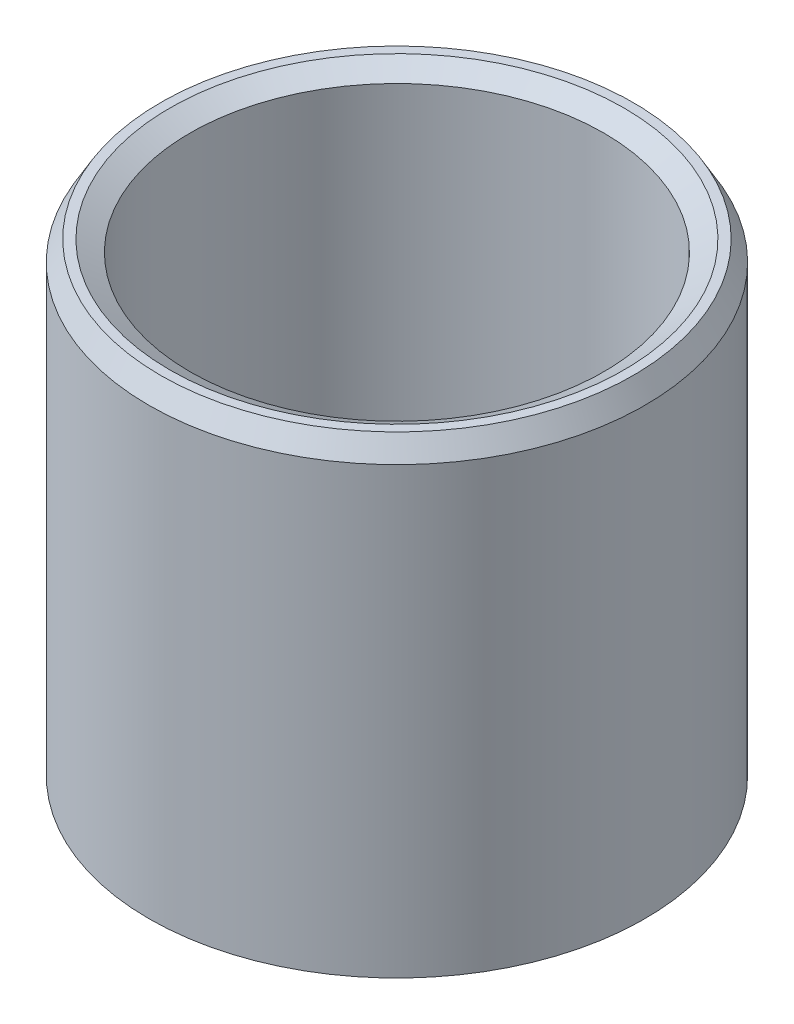
from build123d import *
from OCP.BRepFilletAPI import BRepFilletAPI_MakeChamfer

# Parameters (mm, degrees)
SKETCH1_R           = 42.5
BOSS_EXTRUDE1_DEPTH = 81.645360636
SKETCH2_R           = 35.456587129
CUT_EXTRUDE1_DEPTH  = 102.38276438
CHAMFER1_SIZE       = 3.449317641
CHAMFER1_SIZE2      = 1.991464468


with BuildPart() as part:
    # Sketch1 → Boss-Extrude1 (new body)
    with BuildSketch(Plane(origin=(0, 0, 0), x_dir=(1, 0, 0), z_dir=(0, 1, 0))):
        Circle(SKETCH1_R)
    extrude(amount=BOSS_EXTRUDE1_DEPTH)

    # Sketch2 → Cut-Extrude1 (cut, through all)
    with BuildSketch(Plane(origin=(0, 0, 0), x_dir=(1, 0, 0), z_dir=(0, 1, 0))):
        Circle(SKETCH2_R)
    extrude(amount=CUT_EXTRUDE1_DEPTH, mode=Mode.SUBTRACT)

    # Chamfer1: one chamfer whose edges measure the first distance from different faces: ONE call of the kernel's chamfer builder (chamfer() names one face for all edges)
    chamfer1_edges_1 = [part.edges().sort_by_distance(p)[0] for p in [
        (-35.456587129, 81.645360636, 0),
    ]]
    chamfer1_side_1 = [part.faces().sort_by_distance(p)[0] for p in [
        (-41.297918472, 81.645360636, 0),
    ]]
    chamfer1_edges_2 = [part.edges().sort_by_distance(p)[0] for p in [
        (-35.456587129, 0, 0),
    ]]
    chamfer1_side_2 = [part.faces().sort_by_distance(p)[0] for p in [
        (-35.456587129, 40.822680318, 0),
    ]]
    chamfer1_edges_3 = [part.edges().sort_by_distance(p)[0] for p in [
        (-42.5, 0, 0),
    ]]
    chamfer1_side_3 = [part.faces().sort_by_distance(p)[0] for p in [
        (-41.297918472, 0, 0),
    ]]
    chamfer1_edges_4 = [part.edges().sort_by_distance(p)[0] for p in [
        (-42.5, 81.645360636, 0),
    ]]
    chamfer1_side_4 = [part.faces().sort_by_distance(p)[0] for p in [
        (-42.5, 40.822680318, 0),
    ]]
    chamfer1 = BRepFilletAPI_MakeChamfer(part.part.solid().wrapped)
    for e in chamfer1_edges_1:
        chamfer1.Add(CHAMFER1_SIZE, CHAMFER1_SIZE2, e.wrapped, chamfer1_side_1[0].wrapped)  # the first distance lies on this face
    for e in chamfer1_edges_2:
        chamfer1.Add(CHAMFER1_SIZE, CHAMFER1_SIZE2, e.wrapped, chamfer1_side_2[0].wrapped)  # the first distance lies on this face
    for e in chamfer1_edges_3:
        chamfer1.Add(CHAMFER1_SIZE, CHAMFER1_SIZE2, e.wrapped, chamfer1_side_3[0].wrapped)  # the first distance lies on this face
    for e in chamfer1_edges_4:
        chamfer1.Add(CHAMFER1_SIZE, CHAMFER1_SIZE2, e.wrapped, chamfer1_side_4[0].wrapped)  # the first distance lies on this face
    add(Compound.cast(chamfer1.Shape()), mode=Mode.REPLACE)


solid = part.part
